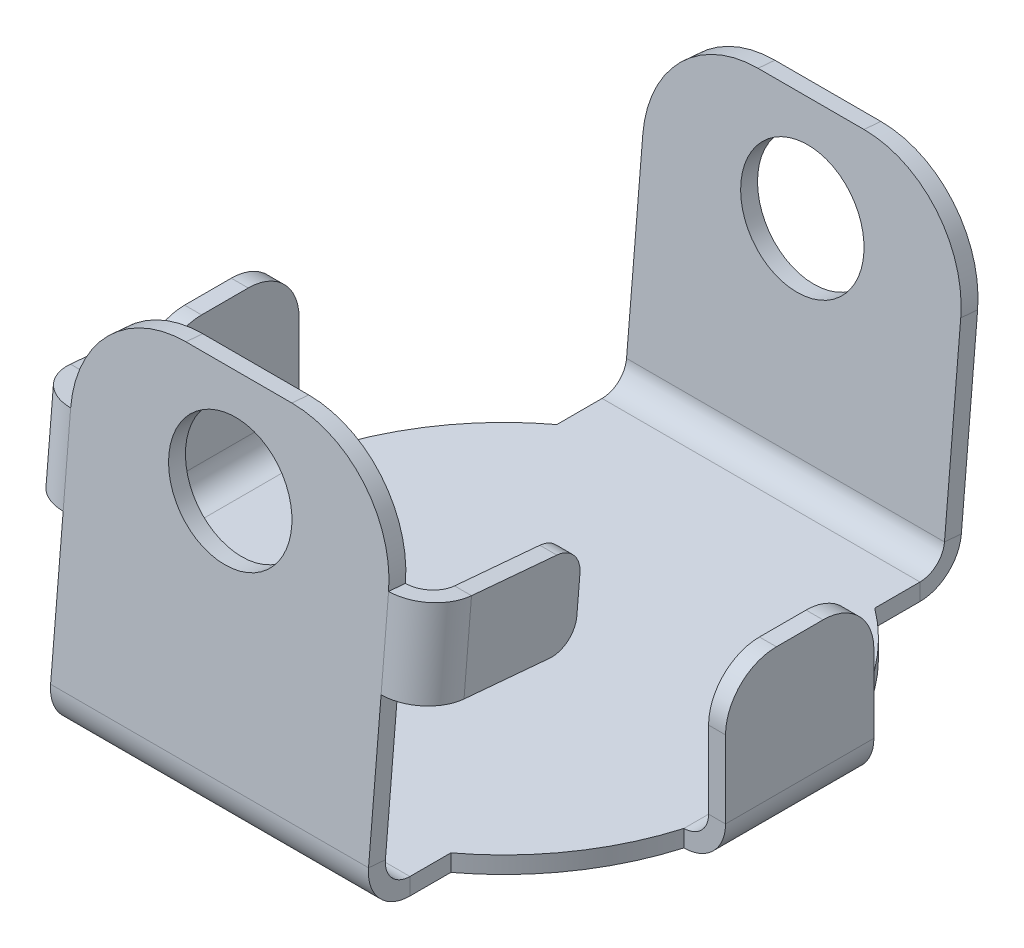
from build123d import *

# Parameters (mm, degrees)
BASE_FLANGE1_DEPTH      = 0.508
EDGE_FLANGE2_START      = -4.7625
EDGE_FLANGE2_DEPTH      = 9.525
EDGE_FLANGE2_2_DEPTH    = 9.525
EDGE_FLANGE3_START      = -4.7625
EDGE_FLANGE3_DEPTH      = 9.525
EDGE_FLANGE3_2_DEPTH    = 9.525
FILLET1_R               = 3.175
SKETCH17_R              = 1.8415
CUT_EXTRUDE1_DEPTH      = 23.441501951
EDGE_FLANGE4_DEPTH      = 4.445
EDGE_FLANGE4_BEND_DEPTH = 4.445
FILLET2_R               = 1.524
EDGE_FLANGE5_DEPTH      = 2.57875744
EDGE_FLANGE5_BEND_DEPTH = 2.57875744
FILLET3_R               = 0.762


# Read off the part's stored shape, not the designer's step: Edge-Flange2, Edge-Flange3
# Sheet-metal steps are written as plain solids
with BuildPart() as part:
    # Sketch1 → Base-Flange1 (new body)
    with BuildSketch(Plane(origin=(0, 0, 0), x_dir=(1, 0, 0), z_dir=(0, 1, 0))):
        with BuildLine():
            Line((-4.7625, -6.35), (-4.7625, -8.89))
            Line((-4.7625, -8.89), (4.7625, -8.89))
            Line((4.7625, -8.89), (4.7625, -6.35))
            ThreePointArc((4.7625, -6.35), (6.526150521, -4.518104207), (7.62, -2.2225))
            Line((7.62, -2.2225), (7.62, 2.2225))
            ThreePointArc((7.62, 2.2225), (6.526150521, 4.518104207), (4.7625, 6.35))
            Line((4.7625, 6.35), (4.7625, 8.89))
            Line((4.7625, 8.89), (-4.7625, 8.89))
            Line((-4.7625, 8.89), (-4.7625, 6.35))
            ThreePointArc((-4.7625, 6.35), (-6.526150521, 4.518104207), (-7.62, 2.2225))
            Line((-7.62, 2.2225), (-7.62, -2.2225))
            ThreePointArc((-7.62, -2.2225), (-6.526150521, -4.518104207), (-4.7625, -6.35))
        make_face()
    extrude(amount=-BASE_FLANGE1_DEPTH)

    # Edge-Flange2 outline → Edge-Flange2 (cut)
    with BuildSketch(Plane.YZ.offset(EDGE_FLANGE2_START)):
        with BuildLine():
            Line((0, -8.89), (0, -8.708309596))
            ThreePointArc((0, -8.708309596), (-0.373760644, -8.267342948), (-0.508, -7.70508998))
            Line((-0.508, -7.70508998), (-0.508, -8.89))
            Line((-0.508, -8.89), (0, -8.89))
        make_face()
    extrude(amount=EDGE_FLANGE2_DEPTH, mode=Mode.SUBTRACT)

    # Edge-Flange2 2 outline → Edge-Flange2 2 (add)
    with BuildSketch(Plane.YZ.offset(EDGE_FLANGE2_START)):
        with BuildLine():
            ThreePointArc((0, -8.708309596), (0.297808861, -8.869775128), (0.628125963, -8.944953901))
            Line((0.628125963, -8.944953901), (9.360304679, -9.708920547))
            Line((9.360304679, -9.708920547), (9.404579797, -9.20285364))
            Line((9.404579797, -9.20285364), (0.67240108, -8.438886994))
            ThreePointArc((0.67240108, -8.438886994), (0.193521514, -8.202729727), (0, -7.70508998))
            Line((0, -7.70508998), (0, -8.708309596))
        make_face()
    extrude(amount=EDGE_FLANGE2_2_DEPTH)

    # Edge-Flange3 outline → Edge-Flange3 (cut)
    with BuildSketch(Plane.YZ.offset(EDGE_FLANGE3_START)):
        with BuildLine():
            ThreePointArc((-0.508, 7.576201681), (-0.373760644, 8.138454649), (0, 8.579421297))
            Line((0, 8.579421297), (0, 8.89))
            Line((0, 8.89), (-0.508, 8.89))
            Line((-0.508, 8.89), (-0.508, 7.576201681))
        make_face()
    extrude(amount=EDGE_FLANGE3_DEPTH, mode=Mode.SUBTRACT)

    # Edge-Flange3 2 outline → Edge-Flange3 2 (add)
    with BuildSketch(Plane.YZ.offset(EDGE_FLANGE3_START)):
        with BuildLine():
            Line((10.878505399, 7.938254101), (0.845074037, 8.816065602))
            ThreePointArc((0.845074037, 8.816065602), (0.400987593, 8.774698018), (0, 8.579421297))
            Line((0, 8.579421297), (0, 7.576201681))
            ThreePointArc((0, 7.576201681), (0.238960253, 8.119280167), (0.80079892, 8.309998695))
            Line((0.80079892, 8.309998695), (10.834230282, 7.432187195))
            Line((10.834230282, 7.432187195), (10.878505399, 7.938254101))
        make_face()
    extrude(amount=EDGE_FLANGE3_2_DEPTH)

    # Fillet1
    fillet1_edges = [part.edges().sort_by_distance(p)[0] for p in [
        (4.7625, 9.382442238, -9.455887093),
        (-4.7625, 9.382442238, -9.455887093),
        (-4.7625, 10.85636784, 7.685220648),
        (4.7625, 10.85636784, 7.685220648),
    ]]
    fillet(fillet1_edges, radius=FILLET1_R)

    # Sketch17 → Cut-Extrude1 (cut, through all)
    with BuildSketch(Plane(origin=(0, 0.77186615, 8.822470462), x_dir=(1, 0, 0), z_dir=(0, 0.08715574274765484, 0.9961946980917459))):
        with Locations(Location((0, 7.18548753, 0), (0, 0, 270))):
            Circle(SKETCH17_R)
    extrude(amount=-CUT_EXTRUDE1_DEPTH, mode=Mode.SUBTRACT)

    # Edge-Flange4 section (across the edge) → Edge-Flange4 (add)
    with BuildSketch(Plane(origin=(-8.3566, 0, -2.2225), x_dir=(1, 0, 0), z_dir=(0, 0, 1))):
        with BuildLine():
            Line((-0.508, 0.7366), (-0.508, 4.572))
            Line((-0.508, 4.572), (0, 4.572))
            Line((0, 4.572), (0, 0.7366))
            ThreePointArc((0, 0.7366), (0.215745145, 0.215745145), (0.7366, 0))
            Line((0.7366, 0), (0.7366, -0.508))
            ThreePointArc((0.7366, -0.508), (-0.1434651, -0.1434651), (-0.508, 0.7366))
        make_face()
    extrude(amount=EDGE_FLANGE4_DEPTH)

    # Edge-Flange4 section 2 (across the edge) → Edge-Flange4 bend (add)
    with BuildSketch(Plane(origin=(8.3566, 0, 2.2225), x_dir=(-1, 0, 0), z_dir=(0, 0, -1))):
        with BuildLine():
            Line((-0.508, 0.7366), (-0.508, 4.572))
            Line((-0.508, 4.572), (0, 4.572))
            Line((0, 4.572), (0, 0.7366))
            ThreePointArc((0, 0.7366), (0.215745145, 0.215745145), (0.7366, 0))
            Line((0.7366, 0), (0.7366, -0.508))
            ThreePointArc((0.7366, -0.508), (-0.1434651, -0.1434651), (-0.508, 0.7366))
        make_face()
    extrude(amount=EDGE_FLANGE4_BEND_DEPTH)

    # Fillet2
    fillet2_edges = [part.edges().sort_by_distance(p)[0] for p in [
        (-8.6106, 4.572, -2.2225),
        (-8.6106, 4.572, 2.2225),
        (8.6106, 4.572, 2.2225),
        (8.6106, 4.572, -2.2225),
    ]]
    fillet(fillet2_edges, radius=FILLET2_R)

    # Edge-Flange5 section (across the edge) → Edge-Flange5 (add)
    with BuildSketch(Plane(origin=(-5.4991, 5.102367626, 7.933660198), x_dir=(1, 0, 0), z_dir=(0, 0.9961946980917459, -0.08715574274765468))):
        with BuildLine():
            Line((-0.508, 0.7366), (-0.508, 4.064))
            Line((-0.508, 4.064), (0, 4.064))
            Line((0, 4.064), (0, 0.7366))
            ThreePointArc((0, 0.7366), (0.215745145, 0.215745145), (0.7366, 0))
            Line((0.7366, 0), (0.7366, -0.508))
            ThreePointArc((0.7366, -0.508), (-0.1434651, -0.1434651), (-0.508, 0.7366))
        make_face()
    extrude(amount=EDGE_FLANGE5_DEPTH)

    # Edge-Flange5 section 2 (across the edge) → Edge-Flange5 bend (add)
    with BuildSketch(Plane(origin=(5.4991, 7.671312115, 7.708906678), x_dir=(-1, 0, 0), z_dir=(0, -0.9961946980917459, 0.08715574274765468))):
        with BuildLine():
            Line((-0.508, 0.7366), (-0.508, 4.064))
            Line((-0.508, 4.064), (0, 4.064))
            Line((0, 4.064), (0, 0.7366))
            ThreePointArc((0, 0.7366), (0.215745145, 0.215745145), (0.7366, 0))
            Line((0.7366, 0), (0.7366, -0.508))
            ThreePointArc((0.7366, -0.508), (-0.1434651, -0.1434651), (-0.508, 0.7366))
        make_face()
    extrude(amount=EDGE_FLANGE5_BEND_DEPTH)

    # Fillet3
    fillet3_edges = [part.edges().sort_by_distance(p)[0] for p in [
        (-5.7531, 4.748166688, 3.885124945),
        (-5.7531, 7.317111177, 3.660371425),
        (5.7531, 7.317111177, 3.660371425),
        (5.7531, 4.748166688, 3.885124945),
    ]]
    fillet(fillet3_edges, radius=FILLET3_R)


solid = part.part
